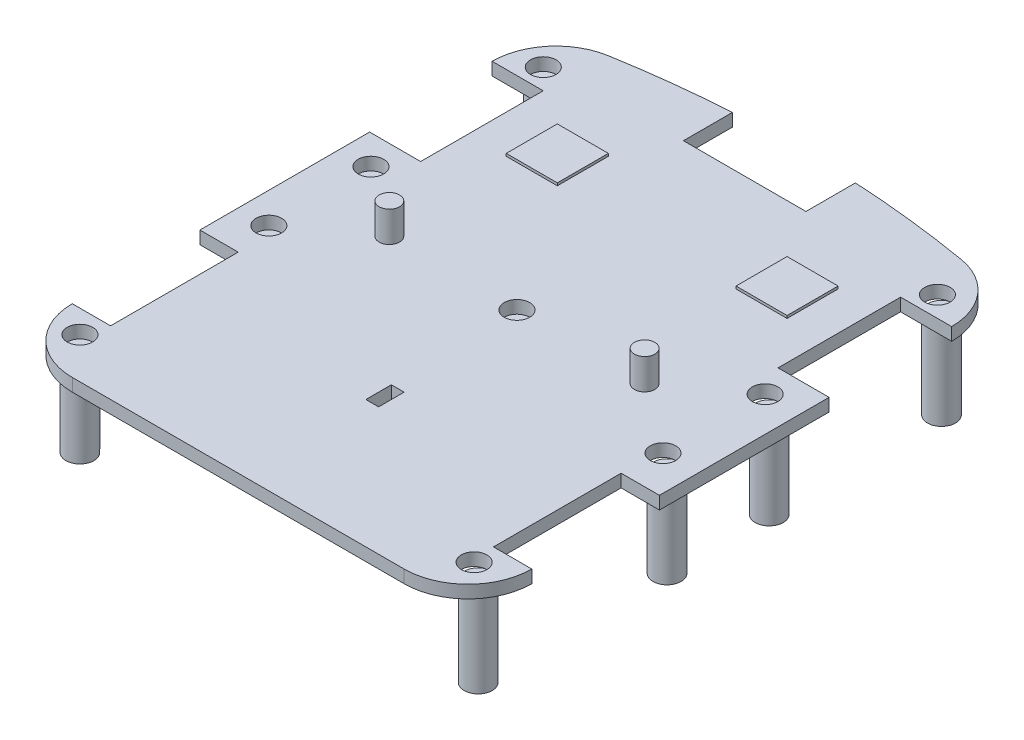
from build123d import *

# Parameters (mm, degrees)
BOSS_EXTRUDE1_DEPTH = 5
SKETCH2_W           = 5
SKETCH2_H           = 10
CUT_EXTRUDE1_DEPTH  = 5
SKETCH3_W           = 20
SKETCH3_H           = 20
BOSS_EXTRUDE2_DEPTH = 1
SKETCH5_R           = 5
CUT_EXTRUDE2_DEPTH  = 10
SKETCH6_R           = 5.5
BOSS_EXTRUDE3_DEPTH = 35
SKETCH7_R           = 4
BOSS_EXTRUDE4_DEPTH = 12


# Read off the part's stored shape, not the designer's step: Boss-Extrude1
with BuildPart() as part:
    # Boss-Extrude1 outline → Boss-Extrude1 (new body)
    with BuildSketch(Plane(origin=(0, 0, 0), x_dir=(1, 0, 0), z_dir=(0, 1, 0))):
        with BuildLine():
            ThreePointArc((-68.420925207, 104.11482166), (-83.313400439, 95.590634086), (-89.202352286, 79.47331922))
            Line((-89.202352286, 79.47331922), (-69.202352286, 79.47331922))
            Line((-69.202352286, 79.47331922), (-69.202352286, 31.47331922))
            Line((-69.202352286, 31.47331922), (-89.202352286, 31.47331922))
            Line((-89.202352286, 31.47331922), (-89.202352286, -35))
            Line((-89.202352286, -35), (-74.202352286, -35))
            Line((-74.202352286, -35), (-74.202352286, -85))
            Line((-74.202352286, -85), (-89.202352286, -85))
            ThreePointArc((-89.202352286, -85), (-81.880021816, -102.67766953), (-64.202352286, -110))
            Line((-64.202352286, -110), (65.797647714, -110))
            ThreePointArc((65.797647714, -110), (83.475317244, -102.67766953), (90.797647714, -85))
            Line((90.797647714, -85), (75.797647714, -85))
            Line((75.797647714, -85), (75.797647714, -35))
            Line((75.797647714, -35), (90.797647714, -35))
            Line((90.797647714, -35), (90.797647714, 31.47331922))
            Line((90.797647714, 31.47331922), (70.797647714, 31.47331922))
            Line((70.797647714, 31.47331922), (70.797647714, 79.47331922))
            Line((70.797647714, 79.47331922), (90.797645004, 79.473319219))
            ThreePointArc((90.797645004, 79.473319219), (84.90638671, 95.581731914), (70.020633234, 104.102425978))
            ThreePointArc((70.020633234, 104.102425978), (46.687380596, 107.414128219), (23.202394477, 109.379701262))
            Line((23.202394477, 109.379701262), (23.202394477, 89.994181642))
            Line((23.202394477, 89.994181642), (-24.797605523, 89.994181642))
            Line((-24.797605523, 89.994181642), (-24.797605523, 109.196602404))
            ThreePointArc((-24.797605523, 109.196602404), (-46.677357907, 107.240236017), (-68.420925207, 104.11482166))
        make_face()
    extrude(amount=BOSS_EXTRUDE1_DEPTH)

    # Sketch2 → Cut-Extrude1 (cut)
    with BuildSketch(Plane(origin=(0, 5, 0), x_dir=(1, 0, 0), z_dir=(0, 1, 0))):
        with Locations((3.297647714, -55)):
            Rectangle(SKETCH2_W, SKETCH2_H)
    extrude(amount=-CUT_EXTRUDE1_DEPTH, mode=Mode.SUBTRACT)

    # Sketch3 → Boss-Extrude2 (add)
    with BuildSketch(Plane(origin=(0, 5, 0), x_dir=(1, 0, 0), z_dir=(0, 1, 0))):
        with Locations((45.797647714, 60)):
            Rectangle(SKETCH3_W, SKETCH3_H)
        with Locations((-44.202352286, 60)):
            Rectangle(SKETCH3_W, SKETCH3_H)
    extrude(amount=BOSS_EXTRUDE2_DEPTH)

    # Sketch5 → Cut-Extrude2 (cut)
    with BuildSketch(Plane(origin=(0, 5, 0), x_dir=(1, 0, 0), z_dir=(0, 1, 0))):
        with Locations(Location((-77.202352286, 20, 0), (0, 0, 270))):
            Circle(SKETCH5_R)
        with Locations(Location((-77.202352286, -20, 0), (0, 0, 270))):
            Circle(SKETCH5_R)
        with Locations(Location((-77.202352286, 87.5, 0), (0, 0, 270))):
            Circle(SKETCH5_R)
        with Locations(Location((-77.202352286, -94, 0), (0, 0, 270))):
            Circle(SKETCH5_R)
        with Locations(Location((0, 0, 0), (0, 0, 270))):
            Circle(SKETCH5_R)
        with Locations(Location((77.202352286, -94, 0), (0, 0, 270))):
            Circle(SKETCH5_R)
        with Locations(Location((77.202352286, -20, 0), (0, 0, 270))):
            Circle(SKETCH5_R)
        with Locations(Location((77.202352286, 20, 0), (0, 0, 270))):
            Circle(SKETCH5_R)
        with Locations(Location((77.202352286, 87.5, 0), (0, 0, 270))):
            Circle(SKETCH5_R)
    extrude(amount=-CUT_EXTRUDE2_DEPTH, mode=Mode.SUBTRACT)

    # Sketch6 → Boss-Extrude3 (add)
    with BuildSketch(Plane.XZ):
        with Locations(Location((-77.202352286, 94, 0), (0, 0, 90))):
            Circle(SKETCH6_R)
        with Locations(Location((-77.202352286, 20, 0), (0, 0, 90))):
            Circle(SKETCH6_R)
        with Locations(Location((-77.202352286, -20, 0), (0, 0, 90))):
            Circle(SKETCH6_R)
        with Locations(Location((-77.202352286, -87.5, 0), (0, 0, 90))):
            Circle(SKETCH6_R)
        with Locations(Location((0, 0, 0), (0, 0, 90))):
            Circle(SKETCH6_R)
        with Locations(Location((78.797647714, -87.5, 0), (0, 0, 90))):
            Circle(SKETCH6_R)
        with Locations(Location((78.797647714, -20, 0), (0, 0, 90))):
            Circle(SKETCH6_R)
        with Locations(Location((78.797647714, 20, 0), (0, 0, 90))):
            Circle(SKETCH6_R)
        with Locations(Location((78.797647714, 94, 0), (0, 0, 90))):
            Circle(SKETCH6_R)
    extrude(amount=BOSS_EXTRUDE3_DEPTH)

    # Sketch7 → Boss-Extrude4 (add)
    with BuildSketch(Plane(origin=(0, 5, 0), x_dir=(1, 0, 0), z_dir=(0, 1, 0))):
        with Locations(Location((-50, 0, 0), (0, 0, 270))):
            Circle(SKETCH7_R)
        with Locations(Location((50, 0, 0), (0, 0, 270))):
            Circle(SKETCH7_R)
    extrude(amount=BOSS_EXTRUDE4_DEPTH)


solid = part.part
